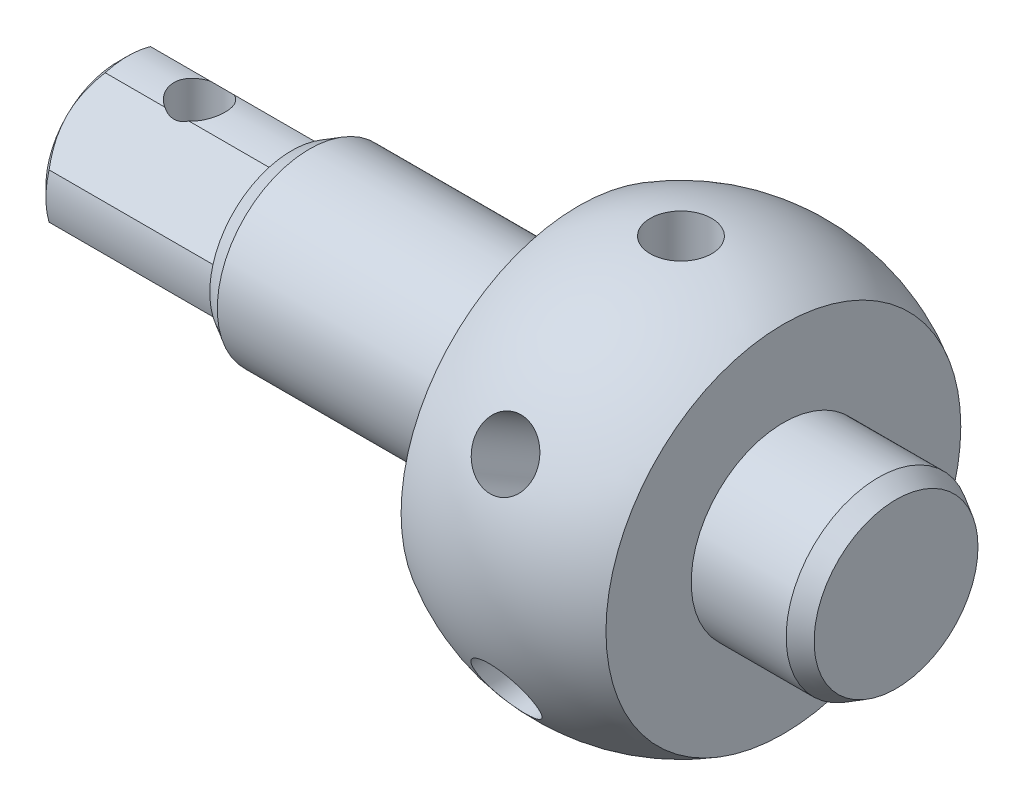
from build123d import *

# Parameters (mm, degrees)
CUT_EXTRUDE_1_DEPTH      = 82.092539731
CUT_EXTRUDE_1_DEPTH_BACK = 82.092539731
SKETCH_2_R               = 3
PATTERN_CIRCULAR_1_COUNT = 2
PATTERN_CIRCULAR_1_ANGLE = 60
SKETCH_6_OUTSIDE_W       = 60.93
SKETCH_6_OUTSIDE_H       = 60.704
CUT_EXTRUDE_2_DEPTH      = 17
HOLE_WIZARD_M61_D        = 5
CUT_EXTRUDE_3_DEPTH      = 10


with BuildPart() as part:
    # Эскиз1 → Повернуть1 (revolve)
    with BuildSketch(Plane.XY, mode=Mode.PRIVATE) as revolve_1_sk:
        with BuildLine():
            Line((0, 0), (0, 8))
            Line((0, 8), (-1.732050808, 9))
            Line((-1.732050808, 9), (-11, 9))
            Line((-11, 9), (-11, 17.320508076))
            ThreePointArc((-11, 17.320508076), (-21, 20), (-31, 17.320508076))
            Line((-31, 17.320508076), (-31, 9))
            Line((-31, 9), (-57.267949192, 9))
            Line((-57.267949192, 9), (-59, 8))
            Line((-59, 8), (-75, 8))
            Line((-75, 8), (-76, 7))
            Line((-76, 7), (-76, 0))
            Line((-76, 0), (0, 0))
        make_face()
    revolve(revolve_1_sk.sketch.rotate(Axis((0, 0, 0), (-1, 0, 0)), 90), axis=Axis((0, 0, 0), (-1, 0, 0)))

    # Эскиз2 → Вырез-Вытянуть1 (cut, two sides: drawn at the far end of the back side and taken through both)
    with BuildSketch(Plane.XY.offset(-CUT_EXTRUDE_1_DEPTH_BACK)):
        with Locations(Location((-21, -10, 0), (0, 0, 235.677064265))):
            Circle(SKETCH_2_R)
    extrude(amount=CUT_EXTRUDE_1_DEPTH + CUT_EXTRUDE_1_DEPTH_BACK, mode=Mode.SUBTRACT)

    # Эскиз4 → Диаметр отверстия Ø6.0 (6)1 (revolve, cut)
    with BuildSketch(Plane(origin=(-21, 20, 0), x_dir=(0, 0, 1), z_dir=(1, 0, 0))):
        Polygon((0, 0), (0, 21.802581857), (3, 20), (3, 0), align=None)
    hole_wizard_6_0_6_1 = revolve(axis=Axis((-21, 20, 0), (0, -1, 0)), mode=Mode.SUBTRACT)

    # Круговой массив1: Диаметр отверстия Ø6.0 (6)1 ×2 about axis
    pattern_circular_1_axis = Axis((0, 0, 0), (1, 0, 0))
    for i in range(1, PATTERN_CIRCULAR_1_COUNT):
        add(hole_wizard_6_0_6_1.rotate(pattern_circular_1_axis, i * PATTERN_CIRCULAR_1_ANGLE / (PATTERN_CIRCULAR_1_COUNT - 1)), mode=Mode.SUBTRACT)

    # Эскиз6 outside → Вырез-Вытянуть2 (cut)
    with BuildSketch(Plane.ZY.offset(76)):
        with Locations((0, -0.113)):
            Rectangle(SKETCH_6_OUTSIDE_W, SKETCH_6_OUTSIDE_H)
        Polygon((-9.899494937, 0), (0, 9.899494937), (9.899494937, 0), (0, -9.899494937), align=None, mode=Mode.SUBTRACT)
    extrude(amount=-CUT_EXTRUDE_2_DEPTH, mode=Mode.SUBTRACT)

    # Отверстие обработанное метчиком M61 (through all)
    with Locations(Plane(origin=(0, 10, 0), x_dir=(1, 0, 0), z_dir=(0, 1, 0))):
        with Locations((-68, 0)):
            Hole(HOLE_WIZARD_M61_D / 2)

    # Эскиз11 → Вырез-Вытянуть3 (cut)
    with BuildSketch(Plane(origin=(0, 10, 0), x_dir=(1, 0, 0), z_dir=(0, 1, 0))):
        Polygon((-76, 0.5), (-75.5, 0), (-76, -0.5), align=None)
    extrude(amount=-CUT_EXTRUDE_3_DEPTH, mode=Mode.SUBTRACT)


solid = part.part
